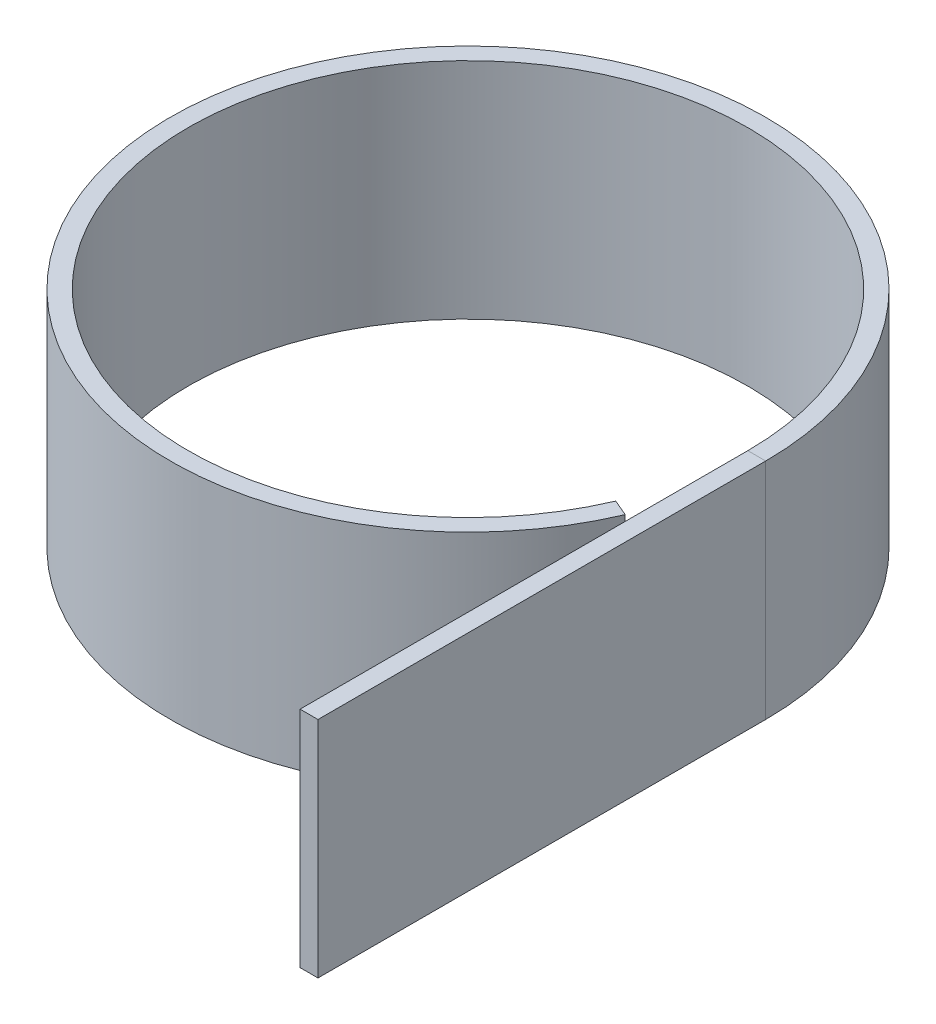
from build123d import *

# Parameters (mm, degrees)
BASE_FLANGE1_DEPTH = 10


# Sheet-metal steps are written as plain solids
with BuildPart() as part:
    # Sketch1 → Base-Flange1 (new body)
    with BuildSketch(Plane(origin=(0, 0, 0), x_dir=(1, 0, 0), z_dir=(0, 1, 0))):
        with BuildLine():
            Line((0, 0), (0, 20))
            ThreePointArc((0, 20), (-24.747448714, 22.5), (-1, 15.101020514))
            Line((-1, 15.101020514), (-0.264, 14.787485827))
            ThreePointArc((-0.264, 14.787485827), (-25.531285432, 22.66), (0.8, 20))
            Line((0.8, 20), (0.8, 0))
            Line((0.8, 0), (0, 0))
        make_face()
    extrude(amount=BASE_FLANGE1_DEPTH)


solid = part.part
